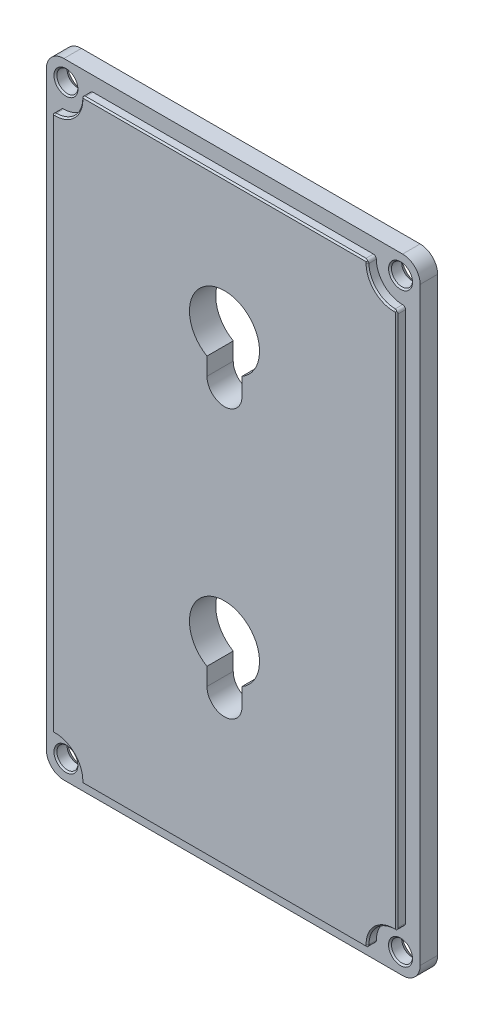
from build123d import *

# Parameters (mm, degrees)
BOSS_EXTRU_1_DEPTH      = 3
BOSS_EXTRU_2_DEPTH      = 1.5
ENL_V_MAT_EXTRU_1_REACH = 266.124
ESQUISSE7_R             = 1.8
CHANFREIN1_SIZE         = 1
CHANFREIN2_SIZE         = 0.25
CONG_1_R                = 0.5
ENL_V_MAT_EXTRU_2_DEPTH = 265.124225417


with BuildPart() as part:
    # Esquisse1 → Boss.-Extru.1 (new body)
    with BuildSketch(Plane.XY):
        with BuildLine():
            Line((-33.076462524, -242.596247682), (-33.076462524, -141.596247682))
            ThreePointArc((-33.076462524, -141.596247682), (-33.955142181, -139.474927339), (-36.076462524, -138.596247682))
            Line((-36.076462524, -138.596247682), (-94.076462524, -138.596247682))
            ThreePointArc((-94.076462524, -138.596247682), (-96.197782868, -139.474927339), (-97.076462524, -141.596247682))
            Line((-97.076462524, -141.596247682), (-97.076462524, -242.596247682))
            ThreePointArc((-97.076462524, -242.596247682), (-96.197782868, -244.717568026), (-94.076462524, -245.596247682))
            Line((-94.076462524, -245.596247682), (-36.076462524, -245.596247682))
            ThreePointArc((-36.076462524, -245.596247682), (-33.955142181, -244.717568026), (-33.076462524, -242.596247682))
        make_face()
    extrude(amount=BOSS_EXTRU_1_DEPTH)

    # Esquisse5 → Boss.-Extru.2 (add)
    with BuildSketch(Plane.XY.offset(3)):
        with BuildLine():
            Line((-40.576462524, -243.096247682), (-40.576462524, -242.596247682))
            ThreePointArc((-40.576462524, -242.596247682), (-39.25844304, -239.414267167), (-36.076462524, -238.096247682))
            Line((-36.076462524, -238.096247682), (-35.576462524, -238.096247682))
            Line((-35.576462524, -238.096247682), (-35.576462524, -146.096247682))
            Line((-35.576462524, -146.096247682), (-36.076462524, -146.096247682))
            ThreePointArc((-36.076462524, -146.096247682), (-39.25844304, -144.778228198), (-40.576462524, -141.596247682))
            Line((-40.576462524, -141.596247682), (-40.576462524, -141.096247682))
            Line((-40.576462524, -141.096247682), (-89.576462524, -141.096247682))
            Line((-89.576462524, -141.096247682), (-89.576462524, -141.596247682))
            ThreePointArc((-89.576462524, -141.596247682), (-90.894482009, -144.778228198), (-94.076462524, -146.096247682))
            Line((-94.076462524, -146.096247682), (-94.576462524, -146.096247682))
            Line((-94.576462524, -146.096247682), (-94.576462524, -238.096247682))
            Line((-94.576462524, -238.096247682), (-94.076462524, -238.096247682))
            ThreePointArc((-94.076462524, -238.096247682), (-90.894482009, -239.414267167), (-89.576462524, -242.596247682))
            Line((-89.576462524, -242.596247682), (-89.576462524, -243.096247682))
            Line((-89.576462524, -243.096247682), (-40.576462524, -243.096247682))
        make_face()
    extrude(amount=BOSS_EXTRU_2_DEPTH)

    # Esquisse7 → Enlèv. mat.-Extru.1 (cut, up to next)
    with BuildSketch(Plane(origin=(0, 0, 0), x_dir=(-1, 0, 0), z_dir=(0, 0, -1)), mode=Mode.PRIVATE) as enl_v_mat_extru_1_sk1:
        with Locations((93.722909134, -242.242694292)):
            Circle(ESQUISSE7_R)
    enl_v_mat_extru_1_tool1 = extrude(enl_v_mat_extru_1_sk1.sketch, amount=-ENL_V_MAT_EXTRU_1_REACH, mode=Mode.PRIVATE) & part.part
    # Esquisse7 → Enlèv. mat.-Extru.1 (cut, up to next)
    with BuildSketch(Plane(origin=(0, 0, 0), x_dir=(-1, 0, 0), z_dir=(0, 0, -1)), mode=Mode.PRIVATE) as enl_v_mat_extru_1_sk2:
        with Locations((93.722909134, -141.949801073)):
            Circle(ESQUISSE7_R)
    enl_v_mat_extru_1_tool2 = extrude(enl_v_mat_extru_1_sk2.sketch, amount=-ENL_V_MAT_EXTRU_1_REACH, mode=Mode.PRIVATE) & part.part
    # Esquisse7 → Enlèv. mat.-Extru.1 (cut, up to next)
    with BuildSketch(Plane(origin=(0, 0, 0), x_dir=(-1, 0, 0), z_dir=(0, 0, -1)), mode=Mode.PRIVATE) as enl_v_mat_extru_1_sk3:
        with Locations((36.430015915, -141.949801073)):
            Circle(ESQUISSE7_R)
    enl_v_mat_extru_1_tool3 = extrude(enl_v_mat_extru_1_sk3.sketch, amount=-ENL_V_MAT_EXTRU_1_REACH, mode=Mode.PRIVATE) & part.part
    # Esquisse7 → Enlèv. mat.-Extru.1 (cut, up to next)
    with BuildSketch(Plane(origin=(0, 0, 0), x_dir=(-1, 0, 0), z_dir=(0, 0, -1)), mode=Mode.PRIVATE) as enl_v_mat_extru_1_sk4:
        with Locations((36.430015915, -242.242694292)):
            Circle(ESQUISSE7_R)
    enl_v_mat_extru_1_tool4 = extrude(enl_v_mat_extru_1_sk4.sketch, amount=-ENL_V_MAT_EXTRU_1_REACH, mode=Mode.PRIVATE) & part.part
    add(enl_v_mat_extru_1_tool1.solids().sort_by_distance((-93.722909, -242.242694, 0))[0], mode=Mode.SUBTRACT)
    add(enl_v_mat_extru_1_tool2.solids().sort_by_distance((-93.722909, -141.949801, 0))[0], mode=Mode.SUBTRACT)
    add(enl_v_mat_extru_1_tool3.solids().sort_by_distance((-36.430016, -141.949801, 0))[0], mode=Mode.SUBTRACT)
    add(enl_v_mat_extru_1_tool4.solids().sort_by_distance((-36.430016, -242.242694, 0))[0], mode=Mode.SUBTRACT)

    # Chanfrein1
    chanfrein1_edges = [part.edges().sort_by_distance(p)[0] for p in [
        (-91.922909134, -242.242694292, 0),
        (-91.922909134, -141.949801073, 0),
        (-34.630015915, -141.949801073, 0),
        (-34.630015915, -242.242694292, 0),
    ]]
    chamfer(chanfrein1_edges, length=CHANFREIN1_SIZE)

    # Chanfrein2
    chanfrein2_edges = [part.edges().sort_by_distance(p)[0] for p in [
        (-65.076462524, -243.096247682, 4.5),
        (-40.576462524, -242.846247682, 4.5),
        (-39.25844304, -239.414267167, 4.5),
        (-35.826462524, -238.096247682, 4.5),
        (-35.576462524, -192.096247682, 4.5),
        (-35.826462524, -146.096247682, 4.5),
        (-39.25844304, -144.778228198, 4.5),
        (-40.576462524, -141.346247682, 4.5),
        (-65.076462524, -141.096247682, 4.5),
        (-89.576462524, -141.346247682, 4.5),
        (-90.894482009, -144.778228198, 4.5),
        (-94.326462524, -146.096247682, 4.5),
        (-94.576462524, -192.096247682, 4.5),
        (-94.326462524, -238.096247682, 4.5),
        (-90.894482009, -239.414267167, 4.5),
        (-89.576462524, -242.846247682, 4.5),
        (-91.922909134, -242.242694292, 3),
        (-91.922909134, -141.949801073, 3),
        (-34.630015915, -141.949801073, 3),
        (-34.630015915, -242.242694292, 3),
    ]]
    chamfer(chanfrein2_edges, length=CHANFREIN2_SIZE)

    # Congé1
    cong_1_edges = [part.edges().sort_by_distance(p)[0] for p in [
        (-94.576462524, -238.096247682, 3.625),
        (-89.576462524, -243.096247682, 3.625),
        (-35.576462524, -146.096247682, 3.625),
        (-40.576462524, -141.096247682, 3.625),
        (-89.576462524, -141.096247682, 3.625),
        (-94.576462524, -146.096247682, 3.625),
        (-35.576462524, -238.096247682, 3.625),
        (-40.576462524, -243.096247682, 3.625),
    ]]
    fillet(cong_1_edges, radius=CONG_1_R - 0.0001)  # a hair under: the kernel refuses the full size

    # Esquisse8 → Enlèv. mat.-Extru.2 (cut, through all)
    with BuildSketch(Plane.XY.offset(4.5)):
        with BuildLine():
            Line((-68.076462524, -171.971247682), (-68.076462524, -168.971247682))
            ThreePointArc((-68.076462524, -168.971247682), (-65.076462524, -157.77509526), (-62.076462524, -168.971247682))
            Line((-62.076462524, -168.971247682), (-62.076462524, -171.971247682))
            ThreePointArc((-62.076462524, -171.971247682), (-65.076462524, -174.971247682), (-68.076462524, -171.971247682))
        make_face()
        with BuildLine():
            Line((-68.076462524, -217.971247682), (-68.076462524, -214.971247682))
            ThreePointArc((-68.076462524, -214.971247682), (-65.076462524, -203.77509526), (-62.076462524, -214.971247682))
            Line((-62.076462524, -214.971247682), (-62.076462524, -217.971247682))
            ThreePointArc((-62.076462524, -217.971247682), (-65.076462524, -220.971247682), (-68.076462524, -217.971247682))
        make_face()
    extrude(amount=-ENL_V_MAT_EXTRU_2_DEPTH, mode=Mode.SUBTRACT)


solid = part.part
